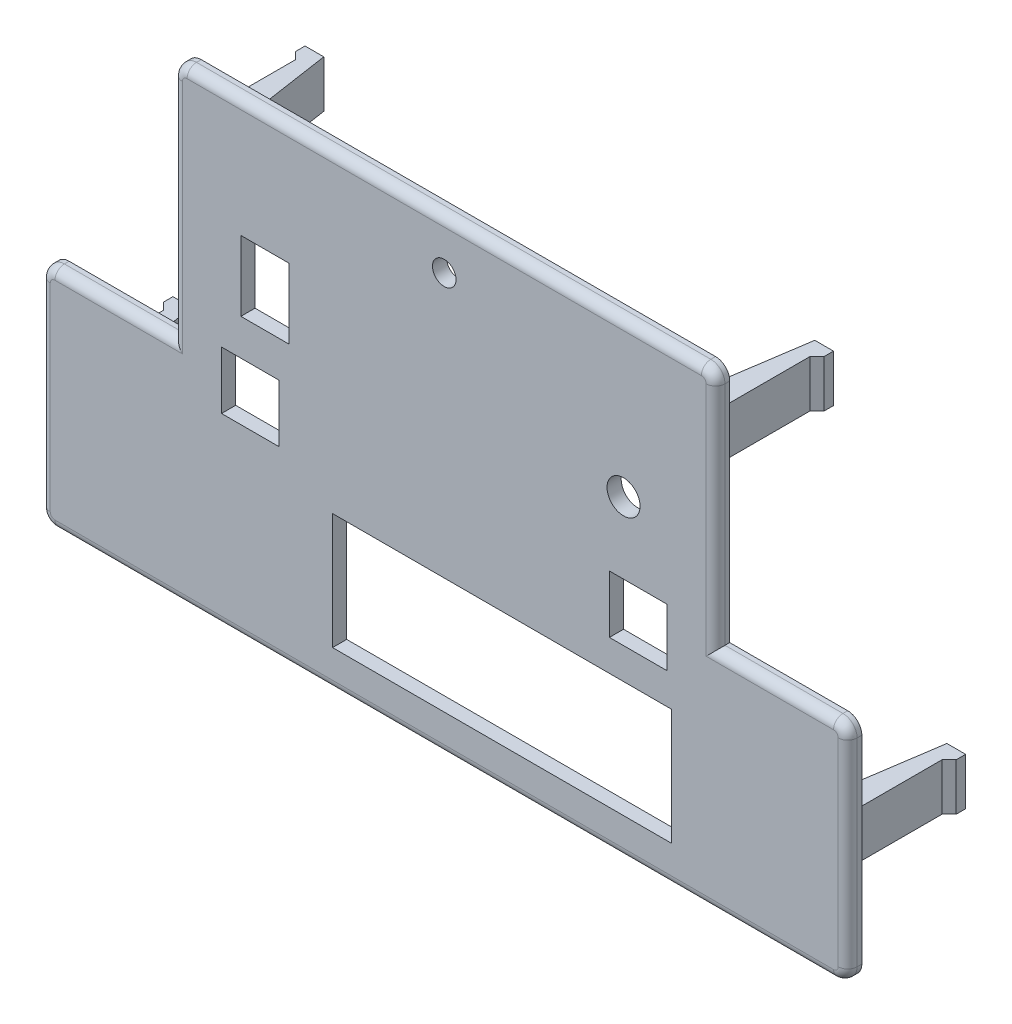
from build123d import *

# Parameters (mm, degrees)
SKETCH1_R           = 2.5
SKETCH1_R_2         = 3.5
SKETCH1_W           = 71.85
SKETCH1_H           = 24.6
SKETCH1_W_2         = 12.2
SKETCH1_H_2         = 12.2
SKETCH1_W_3         = 10.2
SKETCH1_H_3         = 14.85
BOSS_EXTRUDE1_DEPTH = 3
FILLET1_R           = 2
FILLET2_R           = 3
BOSS_EXTRUDE2_START = -10
BOSS_EXTRUDE2_DEPTH = 10
BOSS_EXTRUDE3_START = -10
BOSS_EXTRUDE3_DEPTH = 10


with BuildPart() as part:
    # Sketch1 → Boss-Extrude1 (new body)
    with BuildSketch(Plane.XY):
        Polygon((0, 0), (-115, 0), (-115, -51), (-143, -51), (-143, -99), (-115, -99), (0, -99), (28, -99), (28, -51), (0, -51), align=None)
        with Locations((-57.5, -10.395373235)):
            Circle(SKETCH1_R, mode=Mode.SUBTRACT)
        with Locations((-19.5, -32.493549158)):
            Circle(SKETCH1_R_2, mode=Mode.SUBTRACT)
        with Locations((-45.247302804, -78.7)):
            Rectangle(SKETCH1_W, SKETCH1_H, mode=Mode.SUBTRACT)
        with Locations((-98.6, -53.697377152)):
            Rectangle(SKETCH1_W_2, SKETCH1_H_2, mode=Mode.SUBTRACT)
        with Locations((-95.5, -32.493549158)):
            Rectangle(SKETCH1_W_3, SKETCH1_H_3, mode=Mode.SUBTRACT)
        with Locations((-16.4, -53.697377152)):
            Rectangle(SKETCH1_W_2, SKETCH1_H_2, mode=Mode.SUBTRACT)
    extrude(amount=BOSS_EXTRUDE1_DEPTH)

    # Fillet1
    fillet1_edges = [part.edges().sort_by_distance(p)[0] for p in [
        (-115, -25.5, 3),
        (-129, -51, 3),
        (-143, -75, 3),
        (-57.5, -99, 3),
        (28, -75, 3),
        (14, -51, 3),
        (0, -25.5, 3),
        (-57.5, 0, 3),
    ]]
    fillet(fillet1_edges, radius=FILLET1_R)

    # Fillet2
    # the kernel refuses this fillet: 3 mm, written as the material it takes off along each edge
    with BuildSketch(Plane(origin=(-140, -54, 3), x_dir=(0, 1, 0), z_dir=(1, 0, 0))) as fillet2_piece_1:
        with BuildLine():
            CenterArc((1, -2), 2, 0, 90)
            Line((3, -2), (3, 0))
            Line((3, 0), (1, 0))
        make_face()
    revolve(axis=Axis((-140, -54, 3), (0, 0, 1)), revolution_arc=90, mode=Mode.SUBTRACT)
    with BuildSketch(Plane(origin=(-140, -96, 3), x_dir=(-1, 0, 0), z_dir=(0, 1, 0))) as fillet2_piece_2:
        with BuildLine():
            CenterArc((1, -2), 2, 0, 90)
            Line((3, -2), (3, 0))
            Line((3, 0), (1, 0))
        make_face()
    revolve(axis=Axis((-140, -96, 3), (0, 0, 1)), revolution_arc=90, mode=Mode.SUBTRACT)
    with BuildSketch(Plane(origin=(-112, -3, 3), x_dir=(0, 1, 0), z_dir=(1, 0, 0))) as fillet2_piece_3:
        with BuildLine():
            CenterArc((1, -2), 2, 0, 90)
            Line((3, -2), (3, 0))
            Line((3, 0), (1, 0))
        make_face()
    revolve(axis=Axis((-112, -3, 3), (0, 0, 1)), revolution_arc=90, mode=Mode.SUBTRACT)
    with BuildSketch(Plane(origin=(25, -96, 3), x_dir=(0, -1, 0), z_dir=(-1, 0, 0))) as fillet2_piece_4:
        with BuildLine():
            CenterArc((1, -2), 2, 0, 90)
            Line((3, -2), (3, 0))
            Line((3, 0), (1, 0))
        make_face()
    revolve(axis=Axis((25, -96, 3), (0, 0, 1)), revolution_arc=90, mode=Mode.SUBTRACT)
    with BuildSketch(Plane(origin=(-3, -3, 3), x_dir=(1, 0, 0), z_dir=(0, -1, 0))) as fillet2_piece_5:
        with BuildLine():
            CenterArc((1, -2), 2, 0, 90)
            Line((3, -2), (3, 0))
            Line((3, 0), (1, 0))
        make_face()
    revolve(axis=Axis((-3, -3, 3), (0, 0, 1)), revolution_arc=90, mode=Mode.SUBTRACT)
    with BuildSketch(Plane(origin=(25, -54, 3), x_dir=(1, 0, 0), z_dir=(0, -1, 0))) as fillet2_piece_6:
        with BuildLine():
            CenterArc((1, -2), 2, 0, 90)
            Line((3, -2), (3, 0))
            Line((3, 0), (1, 0))
        make_face()
    revolve(axis=Axis((25, -54, 3), (0, 0, 1)), revolution_arc=90, mode=Mode.SUBTRACT)
    with BuildSketch(Plane(origin=(28, -51, -7.5), x_dir=(-1, 0, 0), z_dir=(0, 0, 1)), Plane(origin=(0, 0, -7.5), x_dir=(-1, 0, 0), z_dir=(0, 0, 1))) as fillet2_piece_7:
        with BuildLine():
            CenterArc((FILLET2_R, FILLET2_R), FILLET2_R, 180, 90)
            Line((0, FILLET2_R), (0, 0))
            Line((0, 0), (FILLET2_R, 0))
        make_face()
    extrude(amount=10.5, mode=Mode.SUBTRACT)
    with BuildSketch(Plane(origin=(-115, 0, -7.5), x_dir=(1, 0, 0), z_dir=(0, 0, 1)), Plane(origin=(-143, -51, -7.5), x_dir=(1, 0, 0), z_dir=(0, 0, 1)), Plane(origin=(28, -99, -7.5), x_dir=(-1, 0, 0), z_dir=(0, 0, 1)), Plane(origin=(-143, -99, -7.5), x_dir=(0, 1, 0), z_dir=(0, 0, 1))) as fillet2_piece_8:
        with BuildLine():
            CenterArc((FILLET2_R, -FILLET2_R), FILLET2_R, 90, 90)
            Line((0, -FILLET2_R), (0, 0))
            Line((0, 0), (FILLET2_R, 0))
        make_face()
    extrude(amount=10.5, mode=Mode.SUBTRACT)

    # Sketch3 → Boss-Extrude2 (add)
    with BuildSketch(Plane(origin=(0, -60, 0), x_dir=(1, 0, 0), z_dir=(0, 1, 0)).offset(BOSS_EXTRUDE2_START)):
        Polygon((25, 0), (25, 20), (26.5, 21.5), (26.5, 23.5), (22.525, 23.5), (19, 0), align=None)
        Polygon((-134, 0), (-140, 0), (-140, 20), (-141.5, 21.5), (-141.5, 23.5), (-137.525, 23.5), align=None)
    extrude(amount=-BOSS_EXTRUDE2_DEPTH)

    # Sketch4 → Boss-Extrude3 (add)
    with BuildSketch(Plane(origin=(0, 0, 0), x_dir=(1, 0, 0), z_dir=(0, 1, 0)).offset(BOSS_EXTRUDE3_START)):
        Polygon((-112, 0), (-106, 0), (-109.525, 23.5), (-113.5, 23.5), (-113.5, 21.5), (-112, 20), align=None)
        Polygon((-1.5, 21.5), (-1.5, 23.5), (-5.475, 23.5), (-9, 0), (-3, 0), (-3, 20), align=None)
    extrude(amount=-BOSS_EXTRUDE3_DEPTH)


solid = part.part
